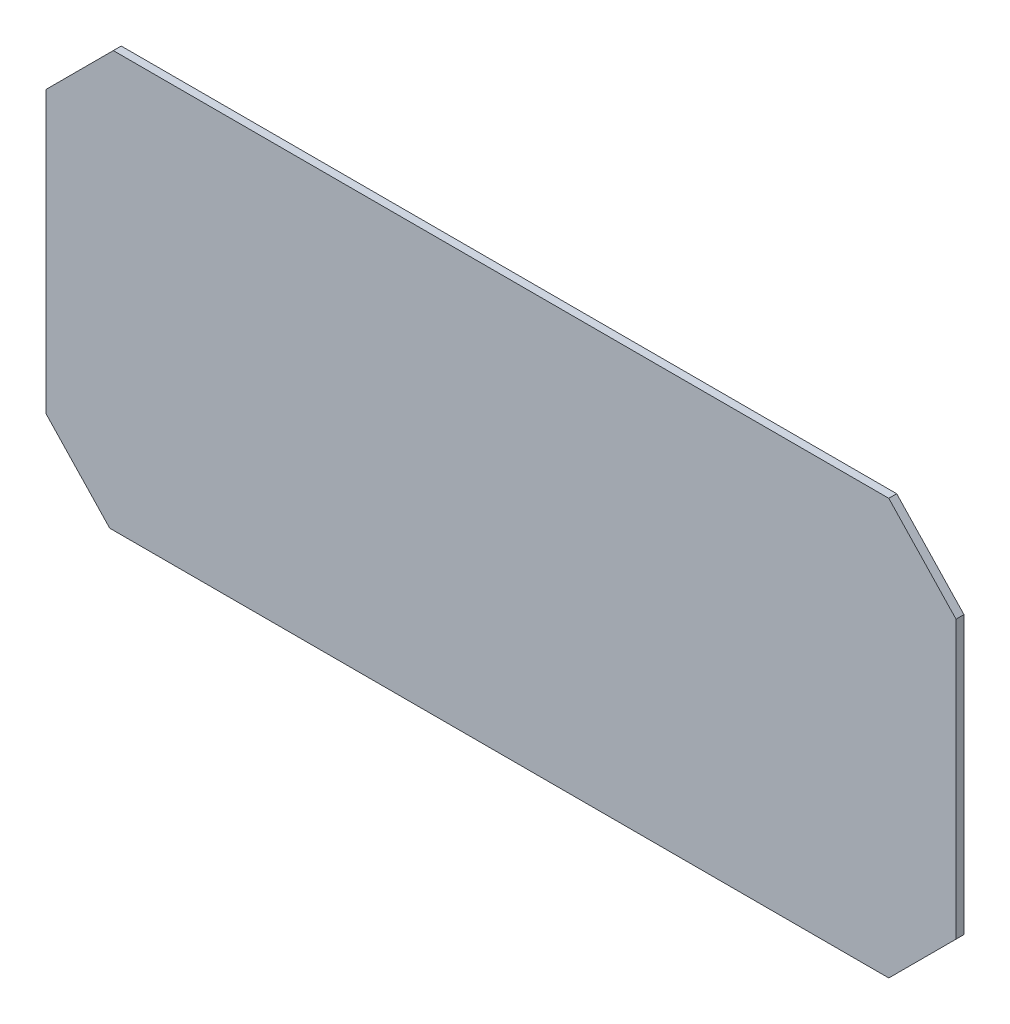
from build123d import *

# Parameters (mm, degrees)
BOSS_EXTRU_1_DEPTH = 2


with BuildPart() as part:
    # Esquisse1 → Boss.-Extru.1 (new body)
    with BuildSketch(Plane.XY):
        Polygon((0, -17), (0, -88), (16.093261094, -105), (213, -105), (230, -88), (230, -17.957827087), (213, 0), (17, 0), align=None)
    extrude(amount=BOSS_EXTRU_1_DEPTH)


solid = part.part
